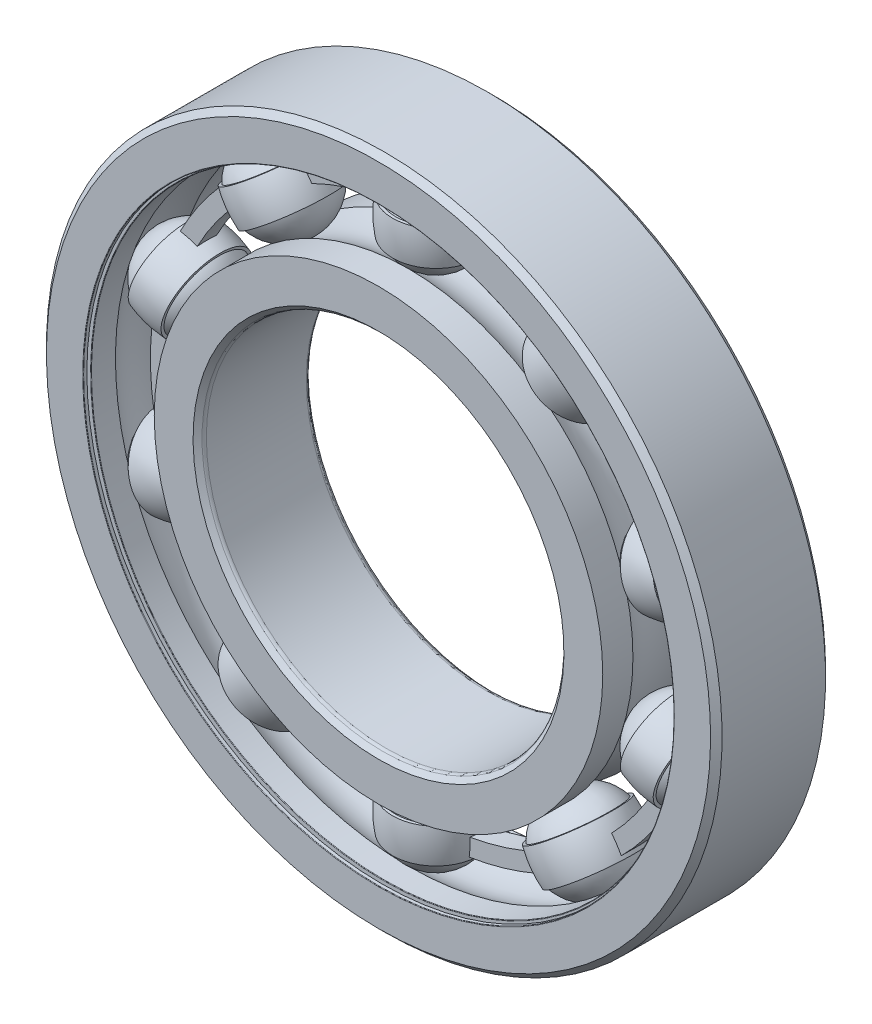
from build123d import *

# Parameters (mm, degrees)
BOSS_EXTRUDE1_DEPTH = 0.666666667
CIRPATTERN1_COUNT   = 10
CIRPATTERN2_COUNT   = 10
FILLET1_R           = 0.036
FILLET2_R           = 0.3


with BuildPart() as part:
    # Sketch3 → Revolve1 (revolve)
    with BuildSketch(Plane(origin=(0, 0, 0), x_dir=(0, 0, -1), z_dir=(1, 0, 0))):
        with BuildLine():
            Line((3.6, 23.5), (4, 23.1))
            Line((4, 23.1), (4, 20.4))
            Line((4, 20.4), (1.9, 20.4))
            ThreePointArc((1.9, 20.4), (0, 21.061045573), (-1.9, 20.4))
            Line((-1.9, 20.4), (-4, 20.4))
            Line((-4, 20.4), (-4, 23.1))
            Line((-4, 23.1), (-3.6, 23.5))
            Line((-3.6, 23.5), (3.6, 23.5))
        make_face()
    revolve(axis=Axis((0, 0, 4), (0, 0, -1)))

    # Sketch8 → Cut-Revolve1 (revolve, cut)
    with BuildSketch(Plane(origin=(0, 0, 0), x_dir=(0, 0, -1), z_dir=(1, 0, 0))):
        Polygon((-3.744, 20.4), (-3.6, 20.4), (-3.6, 21.433333333), (-3.744, 21.433333333), (-3.744, 20.544), (-4, 20.544), (-4, 20.4), align=None)
        Polygon((3.6, 20.4), (3.744, 20.4), (4, 20.4), (4, 20.544), (3.744, 20.544), (3.744, 21.433333333), (3.6, 21.433333333), align=None)
    revolve(axis=Axis((0, 0, 4), (0, 0, -1)), mode=Mode.SUBTRACT)

    # Fillet1
    fillet1_edges = [part.edges().sort_by_distance(p)[0] for p in [
        (0, -20.4, -3.6),
        (0, -20.544, -4),
        (0, -20.4, 3.6),
        (0, -20.544, 4),
    ]]
    fillet(fillet1_edges, radius=FILLET1_R)


with BuildPart() as body_2:
    # Sketch4 → Revolve2 (revolve)
    with BuildSketch(Plane(origin=(0, 0, 0), x_dir=(0, 0, -1), z_dir=(1, 0, 0))):
        with BuildLine():
            Line((-3.6, 12.5), (-4, 12.9))
            Line((-4, 12.9), (-4, 15.6))
            Line((-4, 15.6), (-1.9, 15.6))
            ThreePointArc((-1.9, 15.6), (0, 14.938954427), (1.9, 15.6))
            Line((1.9, 15.6), (4, 15.6))
            Line((4, 15.6), (4, 12.9))
            Line((4, 12.9), (3.6, 12.5))
            Line((3.6, 12.5), (-3.6, 12.5))
        make_face()
    revolve(axis=Axis((0, 0, 4), (0, 0, -1)))

    # Fillet2
    fillet2_edges = [body_2.edges().sort_by_distance(p)[0] for p in [
        (0, -12.5, -3.6),
        (0, -12.5, 3.6),
    ]]
    fillet(fillet2_edges, radius=FILLET2_R)


with BuildPart() as body_3:
    # Sketch5 → Revolve3 (revolve)
    with BuildSketch(Plane(origin=(0, 0, 0), x_dir=(0, 0, -1), z_dir=(1, 0, 0))):
        with BuildLine():
            Line((-3.061045573, 18), (3.061045573, 18))
            ThreePointArc((3.061045573, 18), (0, 21.061045573), (-3.061045573, 18))
        make_face()
    revolve(axis=Axis((0, 18, 3.061045573), (0, 0, -1)))


with BuildPart() as body_4:
    # Sketch6 → Revolve4 (revolve)
    with BuildSketch(Plane(origin=(0, 0, 0), x_dir=(0, 0, -1), z_dir=(1, 0, 0))):
        with BuildLine():
            Line((-2.816025568, 19.2), (-3.01335464, 19.2))
            ThreePointArc((-3.01335464, 19.2), (-3.112019176, 18), (-3.01335464, 16.8))
            Line((-3.01335464, 16.8), (-2.816025568, 16.8))
            ThreePointArc((-2.816025568, 16.8), (-3.061045573, 18), (-2.816025568, 19.2))
        make_face()
    revolve4 = revolve(axis=Axis((0, 23.5, 0), (0, -1, 0)))

    # Sketch7 → Boss-Extrude1 (add, symmetric)
    with BuildSketch(Plane.XY):
        with BuildLine():
            Line((10.91177822, 14.315484486), (11.639230102, 15.269850119))
            ThreePointArc((11.639230102, 15.269850119), (6.142429394, 18.19094723), (0, 19.2))
            Line((0, 19.2), (0, 18))
            ThreePointArc((0, 18), (5.758527557, 17.054013028), (10.91177822, 14.315484486))
        make_face()
    boss_extrude1 = extrude(amount=BOSS_EXTRUDE1_DEPTH, both=True)

    # CirPattern2: Revolve4, Boss-Extrude1 ×10 about axis
    cirpattern2_axis = Axis((0, 0, 4), (0, 0, -1))
    add([revolve4.rotate(cirpattern2_axis, i * 360 / CIRPATTERN2_COUNT) for i in range(1, CIRPATTERN2_COUNT)])
    add([boss_extrude1.rotate(cirpattern2_axis, i * 360 / CIRPATTERN2_COUNT) for i in range(1, CIRPATTERN2_COUNT)])


with BuildPart() as cirpattern1_1:
    # CirPattern1: pattern copy
    add(body_3.part.rotate(Axis((0, 0, 4), (0, 0, -1)), 1 * 360 / CIRPATTERN1_COUNT))


with BuildPart() as cirpattern1_2:
    # CirPattern1: pattern copy
    add(body_3.part.rotate(Axis((0, 0, 4), (0, 0, -1)), 2 * 360 / CIRPATTERN1_COUNT))


with BuildPart() as cirpattern1_3:
    # CirPattern1: pattern copy
    add(body_3.part.rotate(Axis((0, 0, 4), (0, 0, -1)), 3 * 360 / CIRPATTERN1_COUNT))


with BuildPart() as cirpattern1_4:
    # CirPattern1: pattern copy
    add(body_3.part.rotate(Axis((0, 0, 4), (0, 0, -1)), 4 * 360 / CIRPATTERN1_COUNT))


with BuildPart() as cirpattern1_5:
    # CirPattern1: pattern copy
    add(body_3.part.rotate(Axis((0, 0, 4), (0, 0, -1)), 5 * 360 / CIRPATTERN1_COUNT))


with BuildPart() as cirpattern1_6:
    # CirPattern1: pattern copy
    add(body_3.part.rotate(Axis((0, 0, 4), (0, 0, -1)), 6 * 360 / CIRPATTERN1_COUNT))


with BuildPart() as cirpattern1_7:
    # CirPattern1: pattern copy
    add(body_3.part.rotate(Axis((0, 0, 4), (0, 0, -1)), 7 * 360 / CIRPATTERN1_COUNT))


with BuildPart() as cirpattern1_8:
    # CirPattern1: pattern copy
    add(body_3.part.rotate(Axis((0, 0, 4), (0, 0, -1)), 8 * 360 / CIRPATTERN1_COUNT))


with BuildPart() as cirpattern1_9:
    # CirPattern1: pattern copy
    add(body_3.part.rotate(Axis((0, 0, 4), (0, 0, -1)), 9 * 360 / CIRPATTERN1_COUNT))


solid = Compound([part.part, body_2.part, body_3.part, body_4.part, cirpattern1_1.part, cirpattern1_2.part, cirpattern1_3.part, cirpattern1_4.part, cirpattern1_5.part, cirpattern1_6.part, cirpattern1_7.part, cirpattern1_8.part, cirpattern1_9.part])
